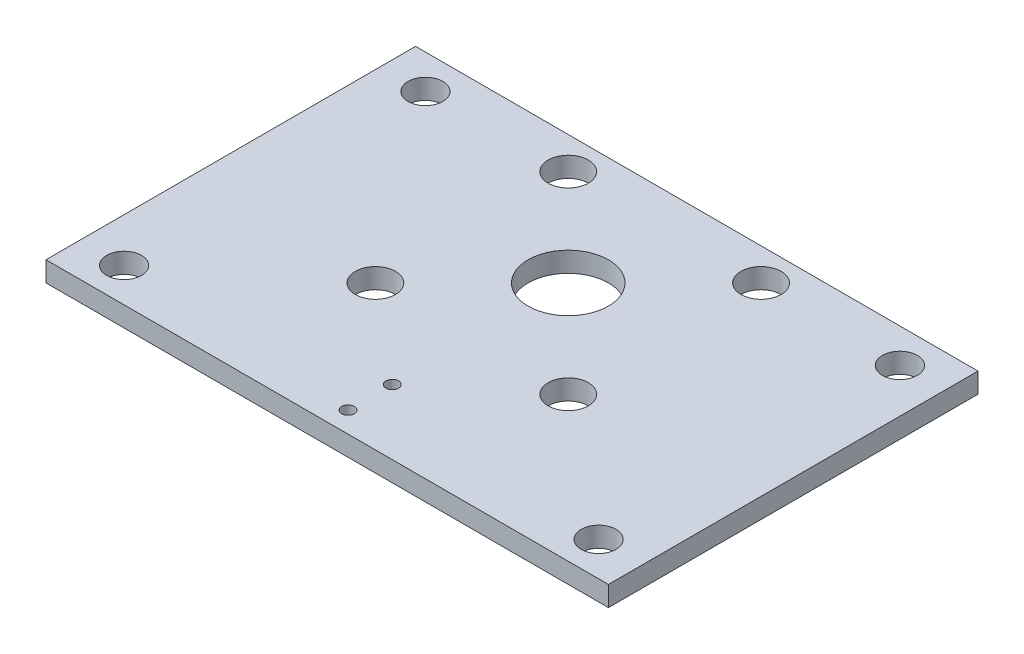
from build123d import *

# Parameters (mm, degrees)
SKETCH1_W                  = 177.8
SKETCH1_H                  = 116.84
BOSS_EXTRUDE1_DEPTH        = 3.175
F_1_1_DIAMETER_HOLE1_D     = 25.4
F_1_2_0_5_DIAMETER_HOLE1_D = 12.7
F_4_0_4_DIAMETER_HOLE1_D   = 4
M10_CLEARANCE_HOLE1_D      = 11


with BuildPart() as part:
    # Sketch1 → Boss-Extrude1 (new, symmetric)
    with BuildSketch(Plane(origin=(0, 0, 0), x_dir=(1, 0, 0), z_dir=(0, 1, 0))):
        with Locations((0, -17.78)):
            Rectangle(SKETCH1_W, SKETCH1_H)
    extrude(amount=BOSS_EXTRUDE1_DEPTH, both=True)

    # 1 (1) Diameter Hole1 (through all)
    with Locations(Plane(origin=(0, 3.175, 0), x_dir=(1, 0, 0), z_dir=(0, 1, 0))):
        with Locations((0, 0)):
            Hole(F_1_1_DIAMETER_HOLE1_D / 2)

    # 1/2 (0.5) Diameter Hole1 (through all)
    with Locations(Plane(origin=(0, 3.175, 0), x_dir=(1, 0, 0), z_dir=(0, 1, 0))):
        with Locations((30.48, -30.48), (-30.48, 30.48), (-30.48, -30.48), (30.48, 30.48)):
            Hole(F_1_2_0_5_DIAMETER_HOLE1_D / 2)

    # Ø4.0 (4) Diameter Hole1 (through all)
    with Locations(Plane(origin=(0, 3.175, 0), x_dir=(1, 0, 0), z_dir=(0, 1, 0))):
        with Locations((0, -55.63), (0, -69.63)):
            Hole(F_4_0_4_DIAMETER_HOLE1_D / 2)

    # M10 Clearance Hole1 (through all)
    with Locations(Plane(origin=(0, 3.175, 0), x_dir=(1, 0, 0), z_dir=(0, 1, 0))):
        with Locations((75, -65.405), (-75, 29.845), (-75, -65.405), (75, 29.845)):
            Hole(M10_CLEARANCE_HOLE1_D / 2)


solid = part.part
